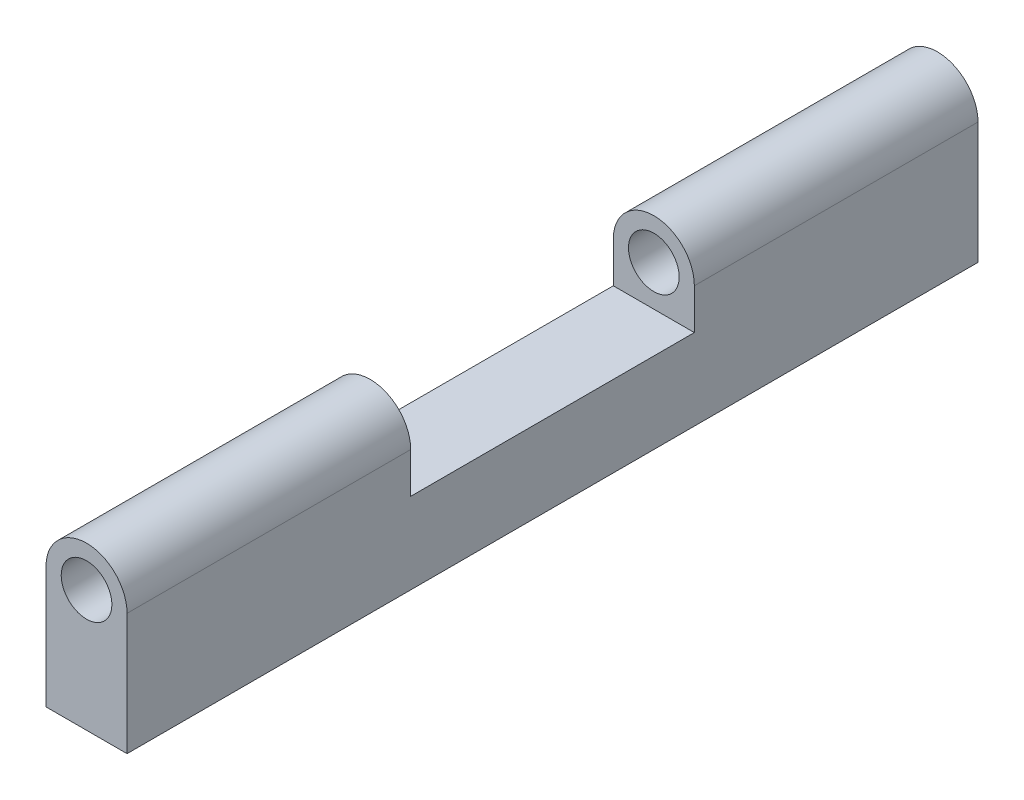
from build123d import *

# Parameters (mm, degrees)
SKETCH1_R               = 1.25
BOSS_EXTRUDE1_DEPTH     = 42
CUT_EXTRUDE1_DEPTH      = 43.328817822
CUT_EXTRUDE1_DEPTH_BACK = 43.328817822
SKETCH2_W               = 14
SKETCH2_H               = 4


with BuildPart() as part:
    # Sketch1 → Boss-Extrude1 (new body)
    with BuildSketch(Plane.XY):
        with BuildLine():
            Line((-2, 2.871223481), (-2, -3.128776519))
            Line((-2, -3.128776519), (2, -3.128776519))
            Line((2, -3.128776519), (2, 2.871223481))
            ThreePointArc((2, 2.871223481), (0, 4.871223481), (-2, 2.871223481))
        make_face()
        with Locations((0, 2.871223481)):
            Circle(SKETCH1_R, mode=Mode.SUBTRACT)
    extrude(amount=BOSS_EXTRUDE1_DEPTH)

    # Sketch2 → Cut-Extrude1 (cut, two sides: drawn at the far end of the back side and taken through both)
    with BuildSketch(Plane(origin=(0, 0, 0), x_dir=(0, 0, -1), z_dir=(1, 0, 0)).offset(-CUT_EXTRUDE1_DEPTH_BACK)):
        with Locations((-21, 2.871223481)):
            Rectangle(SKETCH2_W, SKETCH2_H)
    extrude(amount=CUT_EXTRUDE1_DEPTH + CUT_EXTRUDE1_DEPTH_BACK, mode=Mode.SUBTRACT)


solid = part.part
